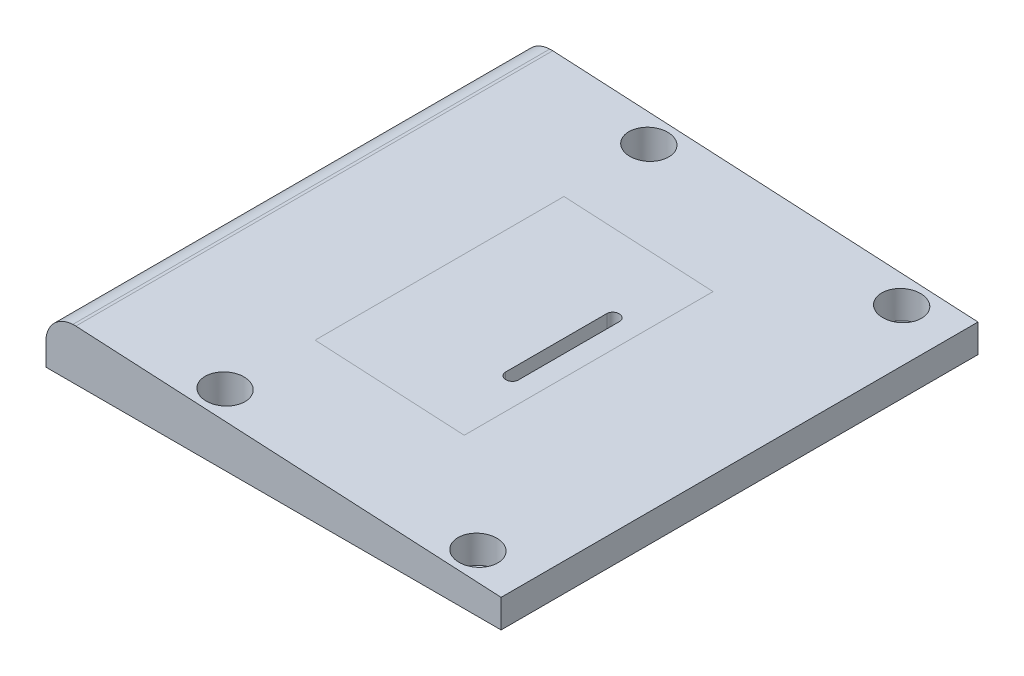
from build123d import *

# Parameters (mm, degrees)
SKETCH1_W                               = 228.6
SKETCH1_H                               = 239.55
BOSS_EXTRUDE1_DEPTH                     = 25.4
CUT_EXTRUDE1_START                      = -119.775
CUT_EXTRUDE1_DEPTH                      = 239.55
CBORE_FOR_M5_HEX_HEAD_BOLT1_D           = 5.5
CBORE_FOR_M5_HEX_HEAD_BOLT1_CBORE_D     = 20
CBORE_FOR_M5_HEX_HEAD_BOLT1_CBORE_DEPTH = 23.58
SPLIT1_SURFACE_1_BACK                   = 333.095
SPLIT1_SURFACE_1_DEPTH                  = 666.19
SPLIT1_SURFACE_2_BACK                   = 333.095
SPLIT1_SURFACE_2_DEPTH                  = 666.19
CUT_EXTRUDE2_DEPTH                      = 260.324450496
CUT_EXTRUDE2_DEPTH_BACK                 = 260.324450496


# Read off the part's stored shape, not the designer's step: Cut-Extrude1
with BuildPart() as part:
    # Sketch1 → Boss-Extrude1 (new body)
    with BuildSketch(Plane(origin=(0, 0, 0), x_dir=(1, 0, 0), z_dir=(0, 1, 0))):
        with Locations((-114.3, 0)):
            Rectangle(SKETCH1_W, SKETCH1_H)
    extrude(amount=BOSS_EXTRUDE1_DEPTH)

    # Cut-Extrude1 outline → Cut-Extrude1 (cut)
    with BuildSketch(Plane.XY.offset(CUT_EXTRUDE1_START)):
        with BuildLine():
            ThreePointArc((-228.6, 12.7), (-224.177702735, 21.523512133), (-215.101143845, 25.4))
            Line((-215.101143845, 25.4), (-228.6, 25.4))
            Line((-228.6, 25.4), (-228.6, 12.7))
        make_face()
        Polygon((0, 25.4), (-213.6, 25.4), (0, 14.205698345), align=None)
    extrude(amount=CUT_EXTRUDE1_DEPTH, mode=Mode.SUBTRACT)

    # CBORE for M5 Hex Head Bolt1 (through all)
    with Locations(Plane(origin=(0, 25.419654417, 0), x_dir=(1, 0, 0), z_dir=(0, 1, 0))):
        with Locations((-152, 106.425), (-25, 106.425), (-25, -106.425), (-152, -106.425)):
            CounterBoreHole(CBORE_FOR_M5_HEX_HEAD_BOLT1_D / 2, CBORE_FOR_M5_HEX_HEAD_BOLT1_CBORE_D / 2, CBORE_FOR_M5_HEX_HEAD_BOLT1_CBORE_DEPTH)


with BuildPart() as body_2:
    # Split1: the piece behind the surface
    add(part.part)
    # Split1 surface: a surface, the sketch's curves swept straight by 666.19 mm
    with BuildLine(Plane(origin=(0.742449909, 14.166788194, 0), x_dir=(0.9986295347545743, -0.05233595624293694, 0), z_dir=(0.052335956242936944, 0.9986295347545744, 0)).offset(-SPLIT1_SURFACE_1_BACK), mode=Mode.PRIVATE) as split1_surface_1_path:
        Line((-76.643355822, -62.5), (-151.643355822, -62.5))
        Line((-151.643355822, -62.5), (-151.643355822, 62.5))
        Line((-151.643355822, 62.5), (-76.643355822, 62.5))
        Line((-76.643355822, 62.5), (-76.643355822, -62.5))
    split1_surface_1 = Shell.extrude(split1_surface_1_path.wire(), (0.052335956 * SPLIT1_SURFACE_1_DEPTH, 0.998629535 * SPLIT1_SURFACE_1_DEPTH, 0 * SPLIT1_SURFACE_1_DEPTH))
    split(bisect_by=split1_surface_1, keep=Keep.BOTTOM)

    # Sketch12 → Cut-Extrude2 (cut, two sides: drawn at the far end of the back side and taken through both)
    with BuildSketch(Plane(origin=(0, 0, 0), x_dir=(1, 0, 0), z_dir=(0, 1, 0)).offset(-CUT_EXTRUDE2_DEPTH_BACK)):
        with BuildLine():
            Line((-92.075, 25.4), (-92.075, -25.4))
            ThreePointArc((-92.075, -25.4), (-88.9, -28.575), (-85.725, -25.4))
            Line((-85.725, -25.4), (-85.725, 25.4))
            ThreePointArc((-85.725, 25.4), (-88.9, 28.575), (-92.075, 25.4))
        make_face()
    extrude(amount=CUT_EXTRUDE2_DEPTH + CUT_EXTRUDE2_DEPTH_BACK, mode=Mode.SUBTRACT)


with BuildPart() as part_1:
    add(part.part)

    # Split1: split by a surface, the side it looks to stays
    # Split1 surface: a surface, the sketch's curves swept straight by 666.19 mm
    with BuildLine(Plane(origin=(0.742449909, 14.166788194, 0), x_dir=(0.9986295347545743, -0.05233595624293694, 0), z_dir=(0.052335956242936944, 0.9986295347545744, 0)).offset(-SPLIT1_SURFACE_2_BACK), mode=Mode.PRIVATE) as split1_surface_2_path:
        Line((-76.643355822, -62.5), (-151.643355822, -62.5))
        Line((-151.643355822, -62.5), (-151.643355822, 62.5))
        Line((-151.643355822, 62.5), (-76.643355822, 62.5))
        Line((-76.643355822, 62.5), (-76.643355822, -62.5))
    split1_surface_2 = Shell.extrude(split1_surface_2_path.wire(), (0.052335956 * SPLIT1_SURFACE_2_DEPTH, 0.998629535 * SPLIT1_SURFACE_2_DEPTH, 0 * SPLIT1_SURFACE_2_DEPTH))
    split(bisect_by=split1_surface_2, keep=Keep.TOP)


solid = Compound([body_2.part, part_1.part])
